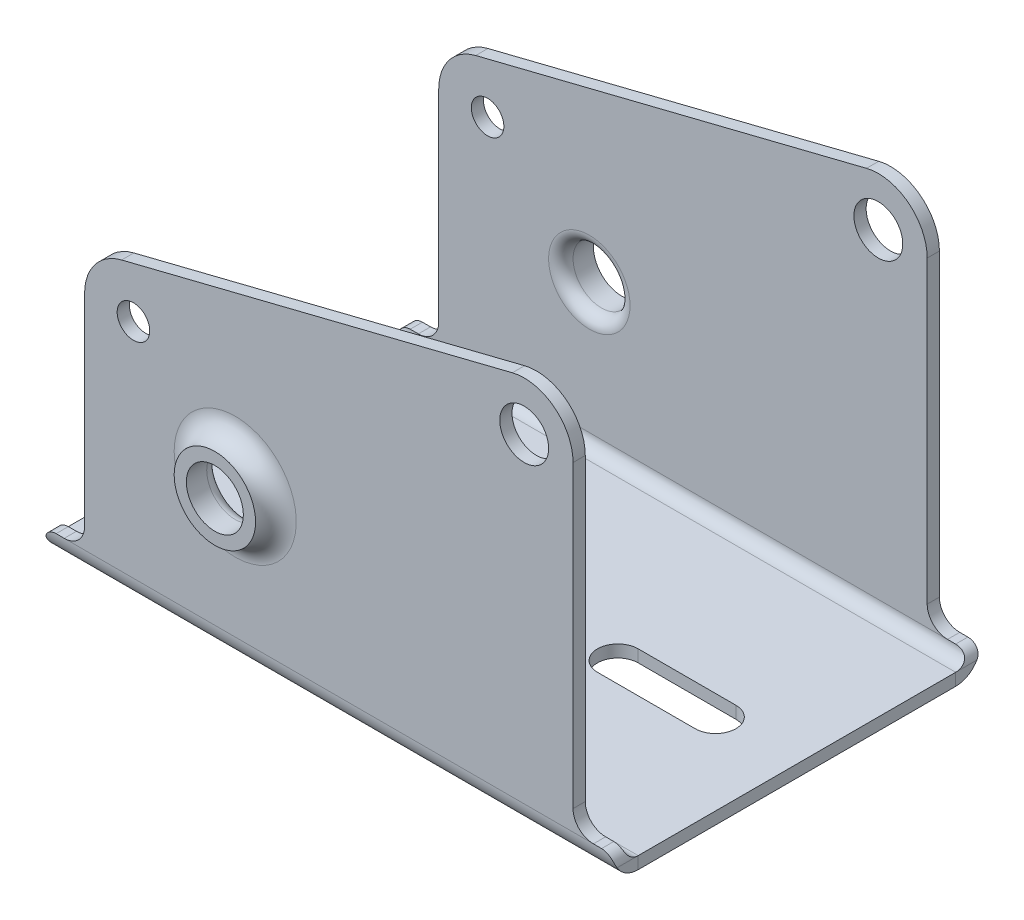
from build123d import *

# Parameters (mm, degrees)
BASE_FLANGE1_DEPTH      = 70
CUT_EXTRUDE1_DEPTH      = 152.657508881
CUT_EXTRUDE1_DEPTH_BACK = 152.657508881
FILLET1_R               = 12
SKETCH7_R               = 4
SKETCH7_R_2             = 6
SKETCH7_R_3             = 7
CUT_EXTRUDE2_DEPTH      = 150.457314712
SKETCH8_R               = 5
CUT_EXTRUDE3_DEPTH      = 10
FILLET2_R               = 3
BOSS_EXTRUDE1_START     = 5
SKETCH9_R               = 10
SKETCH9_R_2             = 7
BOSS_EXTRUDE1_DEPTH     = 5
FILLET3_R               = 5
FILLET4_R               = 3
FILLET5_R               = 3
FILLET6_R               = 5
FILLET7_R               = 5


# Sheet-metal steps are written as plain solids
with BuildPart() as part:
    # Sketch1 → Base-Flange1 (new, symmetric)
    with BuildSketch(Plane(origin=(0, 0, 0), x_dir=(0, 0, -1), z_dir=(1, 0, 0))):
        with BuildLine():
            Line((-45, 100), (-45, 6))
            ThreePointArc((-45, 6), (-43.242640687, 1.757359313), (-39, 0))
            Line((-39, 0), (39, 0))
            ThreePointArc((39, 0), (43.242640687, 1.757359313), (45, 6))
            Line((45, 6), (45, 100))
            Line((45, 100), (42, 100))
            Line((42, 100), (42, 6))
            ThreePointArc((42, 6), (41.121320344, 3.878679656), (39, 3))
            Line((39, 3), (-39, 3))
            ThreePointArc((-39, 3), (-41.121320344, 3.878679656), (-42, 6))
            Line((-42, 6), (-42, 100))
            Line((-42, 100), (-45, 100))
        make_face()
    extrude(amount=BASE_FLANGE1_DEPTH, both=True)

    # Sketch6 → Cut-Extrude1 (cut, two sides: drawn at the far end of the back side and taken through both)
    with BuildSketch(Plane.XY.offset(45).offset(-CUT_EXTRUDE1_DEPTH_BACK)):
        Polygon((-417.259543972, 6), (-70, 6), (-60, 6), (-60, 70), (60, 100), (60, 6), (70, 6), (417.259543972, 6), (417.259543972, 700.519087943), (-417.259543972, 700.519087943), align=None)
    extrude(amount=CUT_EXTRUDE1_DEPTH + CUT_EXTRUDE1_DEPTH_BACK, mode=Mode.SUBTRACT)

    # Fillet1
    fillet1_edges = [part.edges().sort_by_distance(p)[0] for p in [
        (60, 100, -43.5),
        (60, 100, 43.5),
        (-60, 70, -43.5),
        (-60, 70, 43.5),
    ]]
    fillet(fillet1_edges, radius=FILLET1_R)

    # Sketch7 → Cut-Extrude2 (cut, through all)
    with BuildSketch(Plane.XY.offset(45)):
        with Locations((-48, 60.630683123)):
            Circle(SKETCH7_R)
        with Locations((48, 84.630683123)):
            Circle(SKETCH7_R_2)
        with Locations((-23, 38)):
            Circle(SKETCH7_R_3)
    extrude(amount=-CUT_EXTRUDE2_DEPTH, mode=Mode.SUBTRACT)

    # Sketch8 → Cut-Extrude3 (cut)
    with BuildSketch(Plane.XZ):
        with Locations(Location((7, 0, 0), (0, 0, 270))):
            Circle(SKETCH8_R)
        with Locations(Location((-50, 0, 0), (0, 0, 270))):
            Circle(SKETCH8_R)
        with BuildLine():
            Line((26, 5), (50, 5))
            ThreePointArc((50, 5), (55, 0), (50, -5))
            Line((50, -5), (26, -5))
            ThreePointArc((26, -5), (21, 0), (26, 5))
        make_face()
        with BuildLine():
            Line((-45, 27.5), (-45, 22.5))
            ThreePointArc((-45, 22.5), (-50, 17.5), (-55, 22.5))
            Line((-55, 22.5), (-55, 27.5))
            ThreePointArc((-55, 27.5), (-50, 32.5), (-45, 27.5))
        make_face()
        with BuildLine():
            Line((-45, -22.5), (-45, -27.5))
            ThreePointArc((-45, -27.5), (-50, -32.5), (-55, -27.5))
            Line((-55, -27.5), (-55, -22.5))
            ThreePointArc((-55, -22.5), (-50, -17.5), (-45, -22.5))
        make_face()
    extrude(amount=-CUT_EXTRUDE3_DEPTH, mode=Mode.SUBTRACT)

    # Fillet2
    fillet2_edges = [part.edges().sort_by_distance(p)[0] for p in [
        (-70, 6, -43.5),
        (70, 6, -43.5),
        (-70, 6, 43.5),
        (70, 6, 43.5),
    ]]
    fillet(fillet2_edges, radius=FILLET2_R - 0.0001)  # a hair under: the kernel refuses the full size

    # Sketch9 → Boss-Extrude1 (add)
    with BuildSketch(Plane.XY.offset(45).offset(BOSS_EXTRUDE1_START)):
        with Locations(Location((-23, 38, 0), (0, 0, 180))):
            Circle(SKETCH9_R)
        with Locations((-23, 38)):
            Circle(SKETCH9_R_2, mode=Mode.SUBTRACT)
    boss_extrude1 = extrude(amount=-BOSS_EXTRUDE1_DEPTH)

    # Fillet3
    fillet3_edges = [part.edges().sort_by_distance(p)[0] for p in [
        (-13, 38, 45),
    ]]
    fillet(fillet3_edges, radius=FILLET3_R - 0.0001)  # a hair under: the kernel refuses the full size

    # Fillet4
    fillet4_edges = [part.edges().sort_by_distance(p)[0] for p in [
        (-30, 38, 42),
    ]]
    fillet(fillet4_edges, radius=FILLET4_R)

    # Mirror5: Boss-Extrude1 across plane
    add(boss_extrude1.mirror(Plane.XY))

    # Fillet5
    fillet5_edges = [part.edges().sort_by_distance(p)[0] for p in [
        (-30, 38, -42),
    ]]
    fillet(fillet5_edges, radius=FILLET5_R)

    # Fillet6
    fillet6_edges = [part.edges().sort_by_distance(p)[0] for p in [
        (-13, 38, -45),
    ]]
    fillet(fillet6_edges, radius=FILLET6_R - 0.0001)  # a hair under: the kernel refuses the full size

    # Fillet7
    fillet7_edges = [part.edges().sort_by_distance(p)[0] for p in [
        (60, 6, -43.5),
        (60, 6, 43.5),
        (-60, 6, -43.5),
        (-60, 6, 43.5),
    ]]
    fillet(fillet7_edges, radius=FILLET7_R)


solid = part.part
